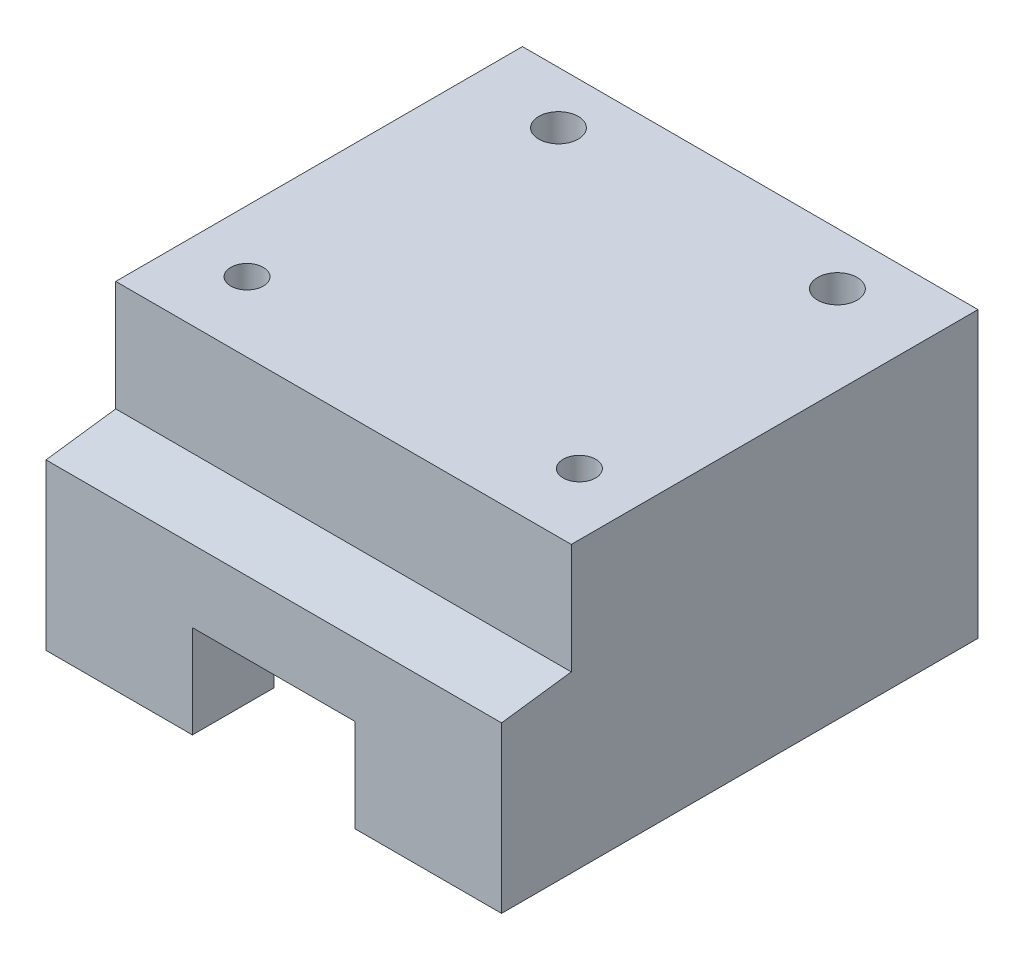
from build123d import *

# Parameters (mm, degrees)
SKETCH_1_W          = 40
SKETCH_1_H          = 20
EXTRUDE_1_DEPTH     = 6
SKETCH_2_W          = 40
SKETCH_2_H          = 32.5
EXTRUDE_2_DEPTH     = 35
CUT_EXTRUDE_1_DEPTH = 13
CUT_EXTRUDE_2_DEPTH = 2
SKETCH_6_W          = 40
SKETCH_6_H          = 41
CUT_EXTRUDE_3_DEPTH = 5
SKETCH_8_R          = 1.7
SKETCH_8_R_2        = 1.4
CUT_EXTRUDE_4_DEPTH = 49.79805324
CUT_EXTRUDE_5_REACH = 48.165
SKETCH_9_W          = 40
SKETCH_9_H          = 3
CHAMFER_1_SIZE2     = 6
CHAMFER_1_SIZE      = 0.8
CUT_EXTRUDE_6_REACH = 49.173
SKETCH_11_W         = 0.4
SKETCH_11_H         = 41


with BuildPart() as part:
    # Эскиз1 → Бобышка-Вытянуть1 (new body)
    with BuildSketch(Plane.XY):
        Rectangle(SKETCH_1_W, SKETCH_1_H)
    extrude(amount=EXTRUDE_1_DEPTH)

    # Эскиз2 → Бобышка-Вытянуть2 (add)
    with BuildSketch(Plane(origin=(0, 0, 0), x_dir=(-1, 0, 0), z_dir=(0, 0, -1))):
        with Locations((0, 6.25)):
            Rectangle(SKETCH_2_W, SKETCH_2_H)
    extrude(amount=EXTRUDE_2_DEPTH)

    # Эскиз3 → Вырез-Вытянуть1 (cut)
    with BuildSketch(Plane.XZ.offset(10)):
        Polygon((-7, 6), (-7, -1), (-8.6, -1), (-8.6, -18.5), (-4.5, -30.5), (-4.5, -34), (-3.5, -34), (-3.5, -35), (3.5, -35), (3.5, -34), (4.5, -34), (4.5, -30.5), (8.6, -18.5), (8.6, -1), (7, -1), (7, 6), align=None)
    extrude(amount=-CUT_EXTRUDE_1_DEPTH, mode=Mode.SUBTRACT)

    # Эскиз5 → Вырез-Вытянуть2 (cut)
    with BuildSketch(Plane.XZ.offset(-3)):
        Polygon((-8.6, -1), (8.6, -1), (8.6, -18.5), (4.5, -30.5), (4.5, -34), (-4.5, -34), (-4.5, -30.5), (-8.6, -18.5), align=None)
    extrude(amount=-CUT_EXTRUDE_2_DEPTH, mode=Mode.SUBTRACT)

    # Эскиз6 → Вырез-Вытянуть3 (cut)
    with BuildSketch(Plane.XZ.offset(10)):
        with Locations((0, -14.5)):
            Rectangle(SKETCH_6_W, SKETCH_6_H)
    extrude(amount=-CUT_EXTRUDE_3_DEPTH, mode=Mode.SUBTRACT)

    # Эскиз8 → Вырез-Вытянуть4 (cut, through all)
    with BuildSketch(Plane.XZ.offset(5)):
        with Locations((12, -30.5)):
            Circle(SKETCH_8_R)
        with Locations((14.3, -6)):
            Circle(SKETCH_8_R_2)
        with Locations(Location((-12, -30.5, 0), (0, 0, 180))):
            Circle(SKETCH_8_R)
        with Locations(Location((-14.3, -6, 0), (0, 0, 180))):
            Circle(SKETCH_8_R_2)
    extrude(amount=-CUT_EXTRUDE_4_DEPTH, mode=Mode.SUBTRACT)

    # Вырез-Вытянуть5: up to this face of the body (flat: up to its plane)
    cut_extrude_5_end = Plane(part.part.faces().sort_by_distance((0, 9.272988506, -35))[0])
    # Эскиз9 → Вырез-Вытянуть5 (cut, up to the picked face)
    with BuildSketch(Plane.XY, mode=Mode.PRIVATE) as cut_extrude_5_sk1:
        with Locations((0, 21)):
            Rectangle(SKETCH_9_W, SKETCH_9_H)
    cut_extrude_5_tool1 = split(extrude(cut_extrude_5_sk1.sketch, amount=-CUT_EXTRUDE_5_REACH, mode=Mode.PRIVATE), bisect_by=cut_extrude_5_end, keep=Keep.BOTH, mode=Mode.PRIVATE)
    add(cut_extrude_5_tool1.solids().sort_by(Axis((0, 21, 0), (0, 0, -1)))[0], mode=Mode.SUBTRACT)

    # Фаска1
    chamfer_1_edges = [part.edges().sort_by_distance(p)[0] for p in [
        (0, 10, 6),
    ]]
    chamfer_1_side = [part.faces().sort_by_distance(p)[0] for p in [
        (0, 9.984, 6),
    ]]
    chamfer(chamfer_1_edges, length=CHAMFER_1_SIZE - 0.0001, length2=CHAMFER_1_SIZE2 - 0.0001, reference=chamfer_1_side[0])  # a hair under: the kernel refuses the full size

    # Вырез-Вытянуть6: up to this face of the body (flat: up to its plane)
    cut_extrude_6_end = Plane(part.part.faces().sort_by_distance((13.552984989, -5, -15.226398396))[0])
    # Эскиз11 → Вырез-Вытянуть6 (cut, up to the picked face)
    with BuildSketch(Plane(origin=(0, 19.5, 0), x_dir=(1, 0, 0), z_dir=(0, 1, 0)), mode=Mode.PRIVATE) as cut_extrude_6_sk1:
        with Locations((-19.8, 14.5)):
            Rectangle(SKETCH_11_W, SKETCH_11_H)
    cut_extrude_6_tool1 = split(extrude(cut_extrude_6_sk1.sketch, amount=-CUT_EXTRUDE_6_REACH, mode=Mode.PRIVATE), bisect_by=cut_extrude_6_end, keep=Keep.BOTH, mode=Mode.PRIVATE)
    # Эскиз11 → Вырез-Вытянуть6 (cut, up to the picked face)
    with BuildSketch(Plane(origin=(0, 19.5, 0), x_dir=(1, 0, 0), z_dir=(0, 1, 0)), mode=Mode.PRIVATE) as cut_extrude_6_sk2:
        with Locations((19.8, 14.5)):
            Rectangle(SKETCH_11_W, SKETCH_11_H)
    cut_extrude_6_tool2 = split(extrude(cut_extrude_6_sk2.sketch, amount=-CUT_EXTRUDE_6_REACH, mode=Mode.PRIVATE), bisect_by=cut_extrude_6_end, keep=Keep.BOTH, mode=Mode.PRIVATE)
    add(cut_extrude_6_tool1.solids().sort_by(Axis((-19.8, 19.5, -14.5), (0, -1, 0)))[0], mode=Mode.SUBTRACT)
    add(cut_extrude_6_tool2.solids().sort_by(Axis((19.8, 19.5, -14.5), (0, -1, 0)))[0], mode=Mode.SUBTRACT)


solid = part.part
